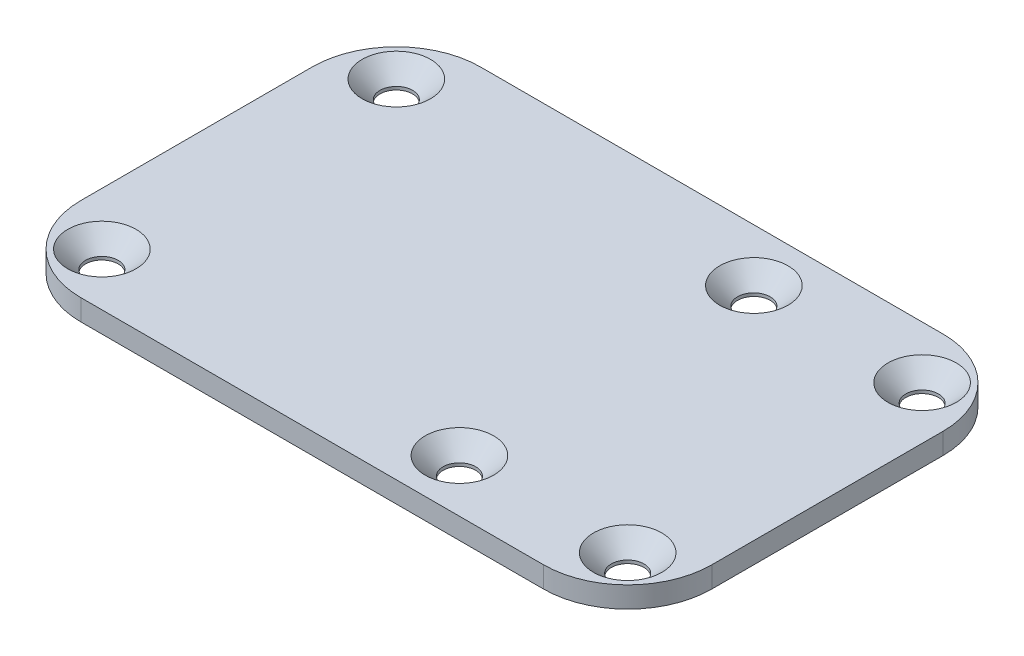
from build123d import *

# Parameters (mm, degrees)
BASE_DEPTH                          = 2
F_3_1_3_1_DIAMETER_HOLE1_AT_2_COUNT = 2
F_3_1_3_1_DIAMETER_HOLE1_AT_2_PITCH = 28
F_3_1_3_1_DIAMETER_HOLE1_AT_3_COUNT = 2
F_3_1_3_1_DIAMETER_HOLE1_AT_3_PITCH = 57.306195128
F_3_1_3_1_DIAMETER_HOLE1_AT_4_COUNT = 2
F_3_1_3_1_DIAMETER_HOLE1_AT_4_PITCH = 50
F_3_1_3_1_DIAMETER_HOLE1_AT_5_COUNT = 2
F_3_1_3_1_DIAMETER_HOLE1_AT_5_PITCH = 16
F_3_1_3_1_DIAMETER_HOLE1_AT_6_COUNT = 2
F_3_1_3_1_DIAMETER_HOLE1_AT_6_PITCH = 32.249030993


with BuildPart() as part:
    # Sketch1 → Base (new body)
    with BuildSketch(Plane(origin=(0, 0, 0), x_dir=(1, 0, 0), z_dir=(0, 1, 0))):
        with BuildLine():
            Line((22, -19), (-22, -19))
            ThreePointArc((-22, -19), (-27.656854249, -16.656854249), (-30, -11))
            Line((-30, -11), (-30, 11))
            ThreePointArc((-30, 11), (-27.656854249, 16.656854249), (-22, 19))
            Line((-22, 19), (22, 19))
            ThreePointArc((22, 19), (27.656854249, 16.656854249), (30, 11))
            Line((30, 11), (30, -11))
            ThreePointArc((30, -11), (27.656854249, -16.656854249), (22, -19))
        make_face()
    extrude(amount=BASE_DEPTH)

    # Hole → Ø3.1 (3.1) Diameter Hole1 (revolve, cut)
    with BuildSketch(Plane(origin=(25, 2, -14), x_dir=(0, 0, 1), z_dir=(1, 0, 0))):
        Polygon((0, 0), (0, 2), (1.55, 2), (1.55, 1.7), (3.25, 0), align=None)
    f_3_1_3_1_diameter_hole1 = revolve(axis=Axis((25, 8.35, -14), (0, -1, 0)), mode=Mode.SUBTRACT)

    # Ø3.1 (3.1) Diameter Hole1 at 2: Ø3.1 (3.1) Diameter Hole1 ×2
    with Locations(*[(0, 0, i * F_3_1_3_1_DIAMETER_HOLE1_AT_2_PITCH) for i in range(1, F_3_1_3_1_DIAMETER_HOLE1_AT_2_COUNT)]):
        add(f_3_1_3_1_diameter_hole1, mode=Mode.SUBTRACT)

    # Ø3.1 (3.1) Diameter Hole1 at 3: Ø3.1 (3.1) Diameter Hole1 ×2
    with Locations(*[Vector(-0.87250601594972, 0, 0.48860336893184336) * (i * F_3_1_3_1_DIAMETER_HOLE1_AT_3_PITCH) for i in range(1, F_3_1_3_1_DIAMETER_HOLE1_AT_3_COUNT)]):
        add(f_3_1_3_1_diameter_hole1, mode=Mode.SUBTRACT)

    # Ø3.1 (3.1) Diameter Hole1 at 4: Ø3.1 (3.1) Diameter Hole1 ×2
    with Locations(*[(-i * F_3_1_3_1_DIAMETER_HOLE1_AT_4_PITCH, 0, 0) for i in range(1, F_3_1_3_1_DIAMETER_HOLE1_AT_4_COUNT)]):
        add(f_3_1_3_1_diameter_hole1, mode=Mode.SUBTRACT)

    # Ø3.1 (3.1) Diameter Hole1 at 5: Ø3.1 (3.1) Diameter Hole1 ×2
    with Locations(*[(-i * F_3_1_3_1_DIAMETER_HOLE1_AT_5_PITCH, 0, 0) for i in range(1, F_3_1_3_1_DIAMETER_HOLE1_AT_5_COUNT)]):
        add(f_3_1_3_1_diameter_hole1, mode=Mode.SUBTRACT)

    # Ø3.1 (3.1) Diameter Hole1 at 6: Ø3.1 (3.1) Diameter Hole1 ×2
    with Locations(*[Vector(-0.4961389383568338, 0, 0.8682431421244593) * (i * F_3_1_3_1_DIAMETER_HOLE1_AT_6_PITCH) for i in range(1, F_3_1_3_1_DIAMETER_HOLE1_AT_6_COUNT)]):
        add(f_3_1_3_1_diameter_hole1, mode=Mode.SUBTRACT)


solid = part.part
